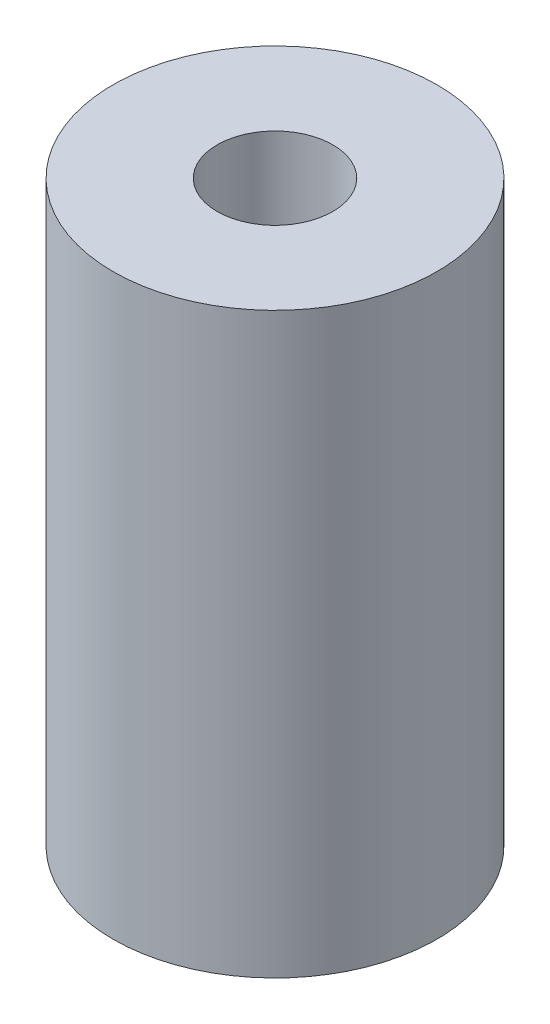
from build123d import *

# Parameters (mm, degrees)
SKETCH_1_R          = 7
EXTRUDE_1_DEPTH     = 25
SKETCH_2_R          = 2.5
CUT_EXTRUDE_1_DEPTH = 12
SKETCH_3_R          = 4
CUT_EXTRUDE_2_DEPTH = 13


with BuildPart() as part:
    # 草图1 → 凸台-拉伸1 (new body)
    with BuildSketch(Plane(origin=(0, 0, 0), x_dir=(1, 0, 0), z_dir=(0, 1, 0))):
        Circle(SKETCH_1_R)
    extrude(amount=EXTRUDE_1_DEPTH)

    # 草图2 → 切除-拉伸1 (cut)
    with BuildSketch(Plane(origin=(0, 25, 0), x_dir=(1, 0, 0), z_dir=(0, 1, 0))):
        Circle(SKETCH_2_R)
    extrude(amount=-CUT_EXTRUDE_1_DEPTH, mode=Mode.SUBTRACT)

    # 草图3 → 切除-拉伸2 (cut)
    with BuildSketch(Plane.XZ):
        Circle(SKETCH_3_R)
    extrude(amount=-CUT_EXTRUDE_2_DEPTH, mode=Mode.SUBTRACT)


solid = part.part
